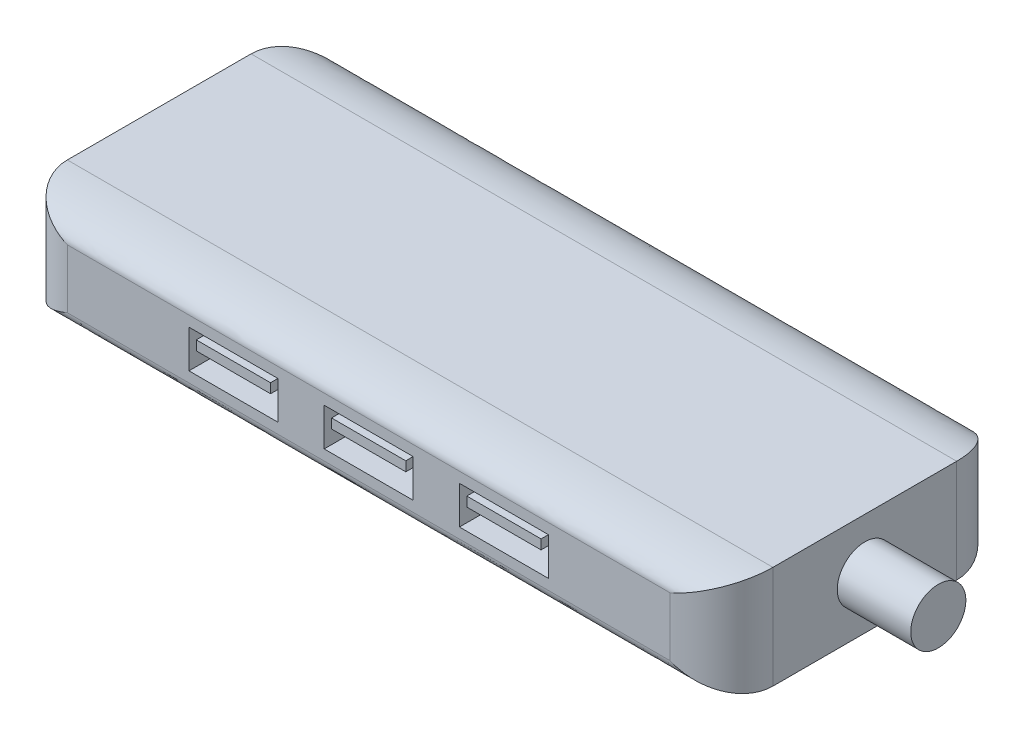
from build123d import *

# Parameters (mm, degrees)
SZKIC1_W                    = 96
SZKIC1_H                    = 39
DODANIE_WYCI_GNI_CIE1_DEPTH = 14
ZAOKR_GLENIE2_SIZE          = 3
ZAOKR_GLENIE2_SIZE_2        = 7
WYTNIJ_WYCI_GNI_CIE1_REACH  = 55.668
SZKIC3_R                    = 3.75
DODANIE_WYCI_GNI_CIE2_DEPTH = 10
DODANIE_WYCI_GNI_CIE3_DEPTH = 1.1
ZAOKR_GLENIE3_R             = 8
WYTNIJ_WYCI_GNI_CIE2_DEPTH  = 11
SZKIC6_W                    = 12.1
SZKIC6_H                    = 5.15
SZKIC6_W_2                  = 10.1
SZKIC6_H_2                  = 1.3
WYTNIJ_WYCI_GNI_CIE3_DEPTH  = 9.75
SZYK_LINIOWY1_COUNT         = 2
SZYK_LINIOWY1_PITCH         = 18.4
LUSTRO1_COPY_1_SKETCH_W     = 12.1
LUSTRO1_COPY_1_SKETCH_H     = 5.15
LUSTRO1_COPY_1_SKETCH_W_2   = 10.1
LUSTRO1_COPY_1_SKETCH_H_2   = 1.3
LUSTRO1_COPY_1_DEPTH        = 9.75
LUSTRO1_COPY_2_SKETCH_W     = 12.1
LUSTRO1_COPY_2_SKETCH_H     = 5.15
LUSTRO1_COPY_2_SKETCH_W_2   = 10.1
LUSTRO1_COPY_2_SKETCH_H_2   = 1.3
LUSTRO1_COPY_2_DEPTH        = 9.75


with BuildPart() as part:
    # Szkic1 → Dodanie-wyciągnięcie1 (new body)
    with BuildSketch(Plane(origin=(0, 0, 0), x_dir=(1, 0, 0), z_dir=(0, 1, 0))):
        Rectangle(SZKIC1_W, SZKIC1_H)
    extrude(amount=DODANIE_WYCI_GNI_CIE1_DEPTH)

    # Zaokrąglenie2
    # an asymmetric fillet: 7, 3 mm, written as the material it takes off along each edge
    with BuildSketch(Plane(origin=(65.5, 0, -19.5), x_dir=(0, 1, 0), z_dir=(-1, 0, 0)), Plane(origin=(-65.5, 0, 19.5), x_dir=(0, 1, 0), z_dir=(1, 0, 0))) as zaokr_glenie2_piece_1:
        with BuildLine():
            Bezier((ZAOKR_GLENIE2_SIZE, 0), (0, 0), (0, -ZAOKR_GLENIE2_SIZE_2), weights=[1, 0.707106781, 1])
            Line((0, -ZAOKR_GLENIE2_SIZE_2), (0, 0))
            Line((0, 0), (ZAOKR_GLENIE2_SIZE, 0))
        make_face()
    extrude(amount=131, mode=Mode.SUBTRACT)
    with BuildSketch(Plane(origin=(65.5, 14, -19.5), x_dir=(0, -1, 0), z_dir=(-1, 0, 0)), Plane(origin=(-65.5, 14, 19.5), x_dir=(0, -1, 0), z_dir=(1, 0, 0))) as zaokr_glenie2_piece_2:
        with BuildLine():
            Bezier((ZAOKR_GLENIE2_SIZE, 0), (0, 0), (0, ZAOKR_GLENIE2_SIZE_2), weights=[1, 0.707106781, 1])
            Line((0, ZAOKR_GLENIE2_SIZE_2), (0, 0))
            Line((0, 0), (ZAOKR_GLENIE2_SIZE, 0))
        make_face()
    extrude(amount=131, mode=Mode.SUBTRACT)

    # Wytnij-wyciągnięcie1: up to this face of the body (flat: up to its plane)
    wytnij_wyci_gni_cie1_end = Plane(part.part.faces().sort_by_distance((0, 0, 0))[0])
    # Szkic2 → Wytnij-wyciągnięcie1 (cut, up to the picked face)
    with BuildSketch(Plane(origin=(0, 14, 0), x_dir=(1, 0, 0), z_dir=(0, 1, 0)), mode=Mode.PRIVATE) as wytnij_wyci_gni_cie1_sk1:
        with BuildLine():
            Line((-48, -19.5), (-41, -19.5))
            ThreePointArc((-41, -19.5), (-45.949747468, -17.449747468), (-48, -12.5))
            Line((-48, -12.5), (-48, -19.5))
        make_face()
    wytnij_wyci_gni_cie1_tool1 = split(extrude(wytnij_wyci_gni_cie1_sk1.sketch, amount=-WYTNIJ_WYCI_GNI_CIE1_REACH, mode=Mode.PRIVATE), bisect_by=wytnij_wyci_gni_cie1_end, keep=Keep.BOTH, mode=Mode.PRIVATE)
    # Szkic2 → Wytnij-wyciągnięcie1 (cut, up to the picked face)
    with BuildSketch(Plane(origin=(0, 14, 0), x_dir=(1, 0, 0), z_dir=(0, 1, 0)), mode=Mode.PRIVATE) as wytnij_wyci_gni_cie1_sk2:
        with BuildLine():
            Line((-48, 19.5), (-41, 19.5))
            ThreePointArc((-41, 19.5), (-45.949747468, 17.449747468), (-48, 12.5))
            Line((-48, 12.5), (-48, 19.5))
        make_face()
    wytnij_wyci_gni_cie1_tool2 = split(extrude(wytnij_wyci_gni_cie1_sk2.sketch, amount=-WYTNIJ_WYCI_GNI_CIE1_REACH, mode=Mode.PRIVATE), bisect_by=wytnij_wyci_gni_cie1_end, keep=Keep.BOTH, mode=Mode.PRIVATE)
    # Szkic2 → Wytnij-wyciągnięcie1 (cut, up to the picked face)
    with BuildSketch(Plane(origin=(0, 14, 0), x_dir=(1, 0, 0), z_dir=(0, 1, 0)), mode=Mode.PRIVATE) as wytnij_wyci_gni_cie1_sk3:
        with BuildLine():
            Line((48, -19.5), (48, -12.5))
            ThreePointArc((48, -12.5), (45.949747468, -17.449747468), (41, -19.5))
            Line((41, -19.5), (48, -19.5))
        make_face()
    wytnij_wyci_gni_cie1_tool3 = split(extrude(wytnij_wyci_gni_cie1_sk3.sketch, amount=-WYTNIJ_WYCI_GNI_CIE1_REACH, mode=Mode.PRIVATE), bisect_by=wytnij_wyci_gni_cie1_end, keep=Keep.BOTH, mode=Mode.PRIVATE)
    # Szkic2 → Wytnij-wyciągnięcie1 (cut, up to the picked face)
    with BuildSketch(Plane(origin=(0, 14, 0), x_dir=(1, 0, 0), z_dir=(0, 1, 0)), mode=Mode.PRIVATE) as wytnij_wyci_gni_cie1_sk4:
        with BuildLine():
            Line((41, 19.5), (48, 19.5))
            Line((48, 19.5), (48, 12.5))
            ThreePointArc((48, 12.5), (45.949747468, 17.449747468), (41, 19.5))
        make_face()
    wytnij_wyci_gni_cie1_tool4 = split(extrude(wytnij_wyci_gni_cie1_sk4.sketch, amount=-WYTNIJ_WYCI_GNI_CIE1_REACH, mode=Mode.PRIVATE), bisect_by=wytnij_wyci_gni_cie1_end, keep=Keep.BOTH, mode=Mode.PRIVATE)
    add(wytnij_wyci_gni_cie1_tool1.solids().sort_by(Axis((-46.436424, 14, 17.936424), (0, -1, 0)))[0], mode=Mode.SUBTRACT)
    add(wytnij_wyci_gni_cie1_tool2.solids().sort_by(Axis((-46.436424, 14, -17.936424), (0, -1, 0)))[0], mode=Mode.SUBTRACT)
    add(wytnij_wyci_gni_cie1_tool3.solids().sort_by(Axis((46.436424, 14, 17.936424), (0, -1, 0)))[0], mode=Mode.SUBTRACT)
    add(wytnij_wyci_gni_cie1_tool4.solids().sort_by(Axis((46.436424, 14, -17.936424), (0, -1, 0)))[0], mode=Mode.SUBTRACT)

    # Szkic3 → Dodanie-wyciągnięcie2 (add)
    with BuildSketch(Plane(origin=(48, 0, 0), x_dir=(0, 0, -1), z_dir=(1, 0, 0))):
        with Locations(Location((0, 7, 0), (0, 0, 180))):
            Circle(SZKIC3_R)
    extrude(amount=DODANIE_WYCI_GNI_CIE2_DEPTH)

    # Szkic4 → Dodanie-wyciągnięcie3 (add)
    with BuildSketch(Plane.XZ):
        with BuildLine():
            Line((-48, 8.5), (-48, -8.5))
            ThreePointArc((-48, -8.5), (-39.5, 0), (-48, 8.5))
        make_face()
    extrude(amount=DODANIE_WYCI_GNI_CIE3_DEPTH)

    # Zaokrąglenie3
    # the kernel refuses this fillet: 8 mm, written as the material it takes off along each edge
    with BuildSketch(Plane(origin=(-48, -1.1, 0), x_dir=(-0.9293459551729958, 0, -0.36921009683321493), z_dir=(-0.36921009683321493, 0, 0.9293459551729958))) as zaokr_glenie3_piece_1:
        with BuildLine():
            CenterArc((4.451543504, -8), ZAOKR_GLENIE3_R, 59.598452337, 30.401547663)
            Line((4.451543504, 0), (4.451543504, 0.16))
            Line((4.451543504, 0.16), (8.5, 0.16))
            Line((8.5, 0.16), (8.66, 0))
            ThreePointArc((8.66, 0), (8.66, -0.55), (8.58096913, -0.962))
            Line((8.58096913, -0.962), (8.5, -1.1))
        make_face()
    revolve(axis=Axis((-48, -1.1, 0), (0, -1, 0)), revolution_arc=316.666179678, mode=Mode.SUBTRACT)

    # Szkic5 → Wytnij-wyciągnięcie2 (cut)
    with BuildSketch(Plane.ZY.offset(48)):
        Polygon((-5.875, 10.6), (5.875, 10.6), (5.875, 3.8), (3.15, 3.8), (3.15, 2.3), (1.65, 2.3), (1.65, 0.8), (-1.65, 0.8), (-1.65, 2.3), (-3.15, 2.3), (-3.15, 3.8), (-5.875, 3.8), align=None)
    extrude(amount=-WYTNIJ_WYCI_GNI_CIE2_DEPTH, mode=Mode.SUBTRACT)

    # Szkic6 → Wytnij-wyciągnięcie3 (cut)
    with BuildSketch(Plane.XY.offset(19.5)):
        with Locations((0, 7)):
            Rectangle(SZKIC6_W, SZKIC6_H)
        with Locations((0, 7.925)):
            Rectangle(SZKIC6_W_2, SZKIC6_H_2, mode=Mode.SUBTRACT)
    wytnij_wyci_gni_cie3 = extrude(amount=-WYTNIJ_WYCI_GNI_CIE3_DEPTH, mode=Mode.SUBTRACT)

    # Szyk liniowy1: Wytnij-wyciągnięcie3 ×2
    with Locations(*[(-i * SZYK_LINIOWY1_PITCH, 0, 0) for i in range(1, SZYK_LINIOWY1_COUNT)]):
        add(wytnij_wyci_gni_cie3, mode=Mode.SUBTRACT)

    # Lustro1 copy 1 sketch → Lustro1 copy 1 (cut)
    with BuildSketch(Plane(origin=(18.4, 0, 19.5), x_dir=(-1, 0, 0), z_dir=(0, 0, 1))):
        with Locations((0, -7)):
            Rectangle(LUSTRO1_COPY_1_SKETCH_W, LUSTRO1_COPY_1_SKETCH_H)
        with Locations((0, -7.925)):
            Rectangle(LUSTRO1_COPY_1_SKETCH_W_2, LUSTRO1_COPY_1_SKETCH_H_2, mode=Mode.SUBTRACT)
    extrude(amount=-LUSTRO1_COPY_1_DEPTH, mode=Mode.SUBTRACT)

    # Lustro1 copy 2 sketch → Lustro1 copy 2 (cut)
    with BuildSketch(Plane(origin=(0, 0, 19.5), x_dir=(-1, 0, 0), z_dir=(0, 0, 1))):
        with Locations((0, -7)):
            Rectangle(LUSTRO1_COPY_2_SKETCH_W, LUSTRO1_COPY_2_SKETCH_H)
        with Locations((0, -7.925)):
            Rectangle(LUSTRO1_COPY_2_SKETCH_W_2, LUSTRO1_COPY_2_SKETCH_H_2, mode=Mode.SUBTRACT)
    extrude(amount=-LUSTRO1_COPY_2_DEPTH, mode=Mode.SUBTRACT)


solid = part.part
